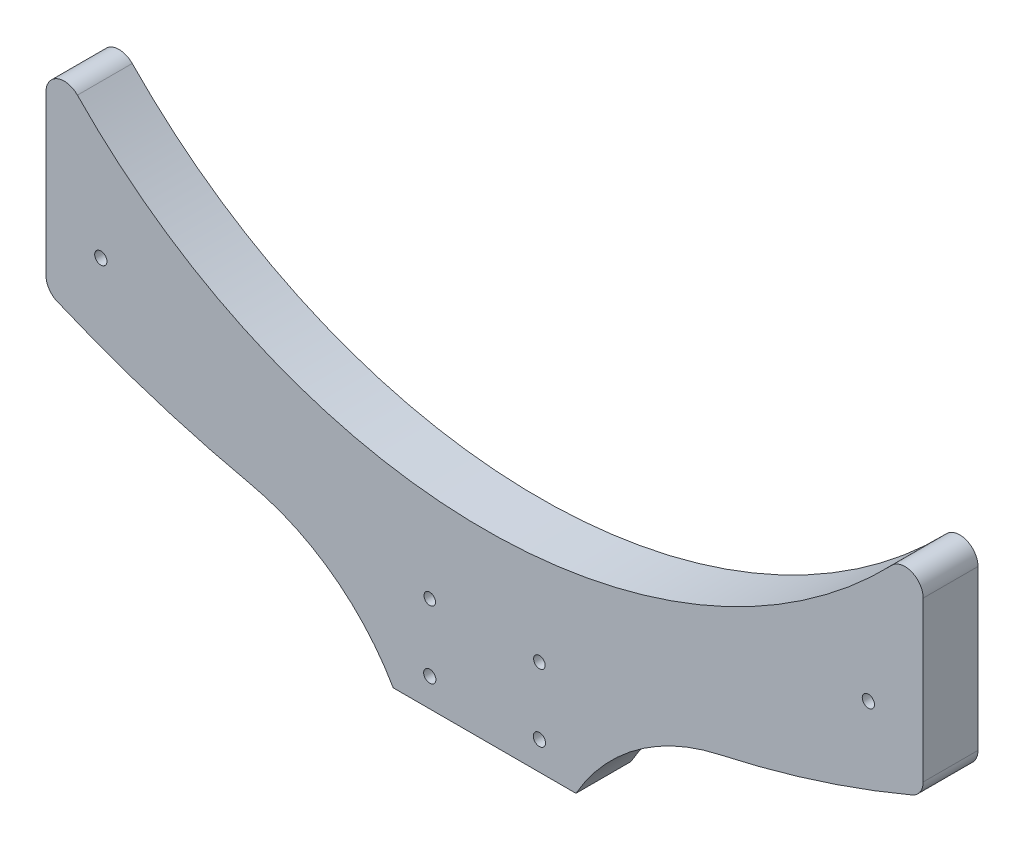
from build123d import *

# Parameters (mm, degrees)
SKETCH1_R           = 2.125
BOSS_EXTRUDE1_DEPTH = 19.05
FILLET1_R           = 6.35
FILLET2_R           = 6.35
SKETCH3_W           = 63.5
SKETCH3_H           = 63.5
BOSS_EXTRUDE2_DEPTH = 19.05
FILLET3_R           = 76.2
SKETCH8_R           = 2.125
CUT_EXTRUDE3_DEPTH  = 19.05
SKETCH10_R          = 2
CUT_EXTRUDE7_DEPTH  = 335.208156388


with BuildPart() as part:
    # Sketch1 → Boss-Extrude1 (new body)
    with BuildSketch(Plane.XY):
        with BuildLine():
            Line((0, 0), (0, -76.2))
            ThreePointArc((0, -76.2), (152.4, -108.007732044), (304.8, -76.2))
            Line((304.8, -76.2), (304.8, 0))
            ThreePointArc((304.8, 0), (152.4, -72.254002873), (0, 0))
        make_face()
        with Locations(Location((19.05, -57.207732044, 0), (0, 0, 180))):
            Circle(SKETCH1_R, mode=Mode.SUBTRACT)
        with Locations(Location((285.75, -57.207732044, 0), (0, 0, 180))):
            Circle(SKETCH1_R, mode=Mode.SUBTRACT)
    extrude(amount=BOSS_EXTRUDE1_DEPTH)

    # Fillet1
    fillet1_edges = [part.edges().sort_by_distance(p)[0] for p in [
        (304.8, 0, 9.525),
        (0, 0, 9.525),
    ]]
    fillet(fillet1_edges, radius=FILLET1_R)

    # Fillet2
    fillet2_edges = [part.edges().sort_by_distance(p)[0] for p in [
        (304.8, -76.2, 9.525),
        (0, -76.2, 9.525),
    ]]
    fillet(fillet2_edges, radius=FILLET2_R)

    # Sketch3 → Boss-Extrude2 (add)
    with BuildSketch(Plane.XY.offset(19.05)):
        with Locations((152.4, -104.004002873)):
            Rectangle(SKETCH3_W, SKETCH3_H)
    extrude(amount=-BOSS_EXTRUDE2_DEPTH)

    # Fillet3
    # the kernel refuses this fillet: 76.2 mm, written as the material it adds along each edge
    with BuildSketch(Plane(origin=(184.15, -106.682510638, 19.05), x_dir=(0.9888312847973341, 0.1490392237166227, 0), z_dir=(0, 0, -1))) as fillet3_piece_1:
        with BuildLine():
            CenterArc((55.420290143, 76.033258895), FILLET3_R, 218.356834864, 47.852104701)
            Line((-4.332792635, 28.746801018), (-5.527854291, 27.801071861))
            ThreePointArc((-5.527854291, 27.801071861), (-3.673375196, 14.146264732), (-1.506978878, -0.227135777))
            Line((-1.506978878, -0.227135777), (0.100764164, -1.520665178))
            ThreePointArc((0.100764164, -1.520665178), (25.191040974, -0.690294475), (50.281317784, -1.520665178))
            Line((50.281317784, -1.520665178), (50.382081948, 0))
        make_face()
    extrude(amount=19.05)
    with BuildSketch(Plane(origin=(120.65, -106.682510638, 19.05), x_dir=(0, -1, 0), z_dir=(0, 0, -1))) as fillet3_piece_2:
        with BuildLine():
            CenterArc((66.924268059, 66.133254588), FILLET3_R, 192.362312718, 47.852104701)
            Line((-7.508906383, 49.819378823), (-8.997569872, 49.493101308))
            ThreePointArc((-8.997569872, 49.493101308), (-4.437037964, 24.806808459), (-1.518699114, -0.127))
            Line((-1.518699114, -0.127), (0, -1.524))
            ThreePointArc((0, -1.524), (14.535746118, -1.524), (28.314436719, -1.322665092))
            Line((28.314436719, -1.322665092), (29.071492235, 0))
        make_face()
    extrude(amount=19.05)

    # Sketch8 → Cut-Extrude3 (cut)
    with BuildSketch(Plane(origin=(0, 0, 0), x_dir=(-1, 0, 0), z_dir=(0, 0, -1))):
        with Locations((-171.45, -125.902330937)):
            Circle(SKETCH8_R)
        with Locations((-133.35, -125.902330937)):
            Circle(SKETCH8_R)
    extrude(amount=-CUT_EXTRUDE3_DEPTH, mode=Mode.SUBTRACT)

    # Sketch10 → Cut-Extrude7 (cut, through all)
    with BuildSketch(Plane.XY.offset(19.05)):
        with Locations((133.35, -102.618997603)):
            Circle(SKETCH10_R)
        with Locations((171.45, -102.618997603)):
            Circle(SKETCH10_R)
    extrude(amount=-CUT_EXTRUDE7_DEPTH, mode=Mode.SUBTRACT)


solid = part.part
